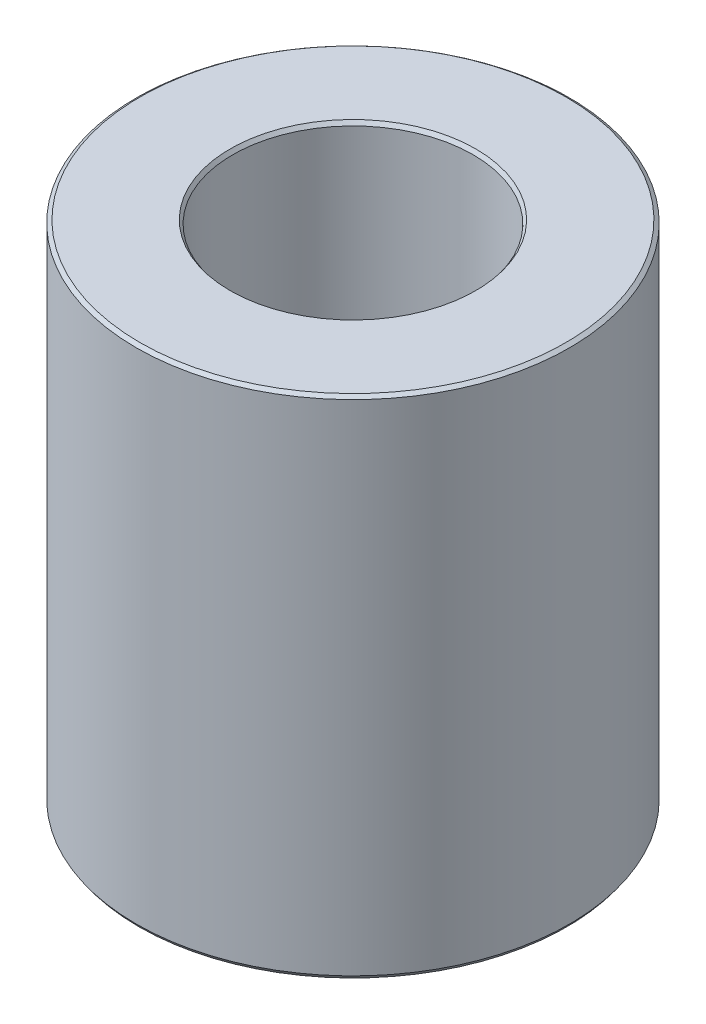
from build123d import *
from OCP.BRepFilletAPI import BRepFilletAPI_MakeChamfer

# Parameters (mm, degrees)
SKETCH1_R           = 42.5
BOSS_EXTRUDE1_DEPTH = 99.188346906
SKETCH2_R           = 23.581922181
CUT_EXTRUDE1_DEPTH  = 116.977705452
CHAMFER1_SIZE       = 0.519594083
CHAMFER1_SIZE2      = 0.728502608


with BuildPart() as part:
    # Sketch1 → Boss-Extrude1 (new body)
    with BuildSketch(Plane(origin=(0, 0, 0), x_dir=(1, 0, 0), z_dir=(0, 1, 0))):
        Circle(SKETCH1_R)
    extrude(amount=BOSS_EXTRUDE1_DEPTH)

    # Sketch2 → Cut-Extrude1 (cut, through all)
    with BuildSketch(Plane(origin=(0, 0, 0), x_dir=(1, 0, 0), z_dir=(0, 1, 0))):
        Circle(SKETCH2_R)
    extrude(amount=CUT_EXTRUDE1_DEPTH, mode=Mode.SUBTRACT)

    # Chamfer1: one chamfer whose edges measure the first distance from different faces: ONE call of the kernel's chamfer builder (chamfer() names one face for all edges)
    chamfer1_edges_1 = [part.edges().sort_by_distance(p)[0] for p in [
        (-23.581922181, 99.188346906, 0),
    ]]
    chamfer1_side_1 = [part.faces().sort_by_distance(p)[0] for p in [
        (-41.297918472, 99.188346906, 0),
    ]]
    chamfer1_edges_2 = [part.edges().sort_by_distance(p)[0] for p in [
        (-23.581922181, 0, 0),
    ]]
    chamfer1_side_2 = [part.faces().sort_by_distance(p)[0] for p in [
        (-23.581922181, 49.594173453, 0),
    ]]
    chamfer1_edges_3 = [part.edges().sort_by_distance(p)[0] for p in [
        (-42.5, 0, 0),
    ]]
    chamfer1_side_3 = [part.faces().sort_by_distance(p)[0] for p in [
        (-41.297918472, 0, 0),
    ]]
    chamfer1_edges_4 = [part.edges().sort_by_distance(p)[0] for p in [
        (-42.5, 99.188346906, 0),
    ]]
    chamfer1_side_4 = [part.faces().sort_by_distance(p)[0] for p in [
        (-42.5, 49.594173453, 0),
    ]]
    chamfer1 = BRepFilletAPI_MakeChamfer(part.part.solid().wrapped)
    for e in chamfer1_edges_1:
        chamfer1.Add(CHAMFER1_SIZE, CHAMFER1_SIZE2, e.wrapped, chamfer1_side_1[0].wrapped)  # the first distance lies on this face
    for e in chamfer1_edges_2:
        chamfer1.Add(CHAMFER1_SIZE, CHAMFER1_SIZE2, e.wrapped, chamfer1_side_2[0].wrapped)  # the first distance lies on this face
    for e in chamfer1_edges_3:
        chamfer1.Add(CHAMFER1_SIZE, CHAMFER1_SIZE2, e.wrapped, chamfer1_side_3[0].wrapped)  # the first distance lies on this face
    for e in chamfer1_edges_4:
        chamfer1.Add(CHAMFER1_SIZE, CHAMFER1_SIZE2, e.wrapped, chamfer1_side_4[0].wrapped)  # the first distance lies on this face
    add(Compound.cast(chamfer1.Shape()), mode=Mode.REPLACE)


solid = part.part
